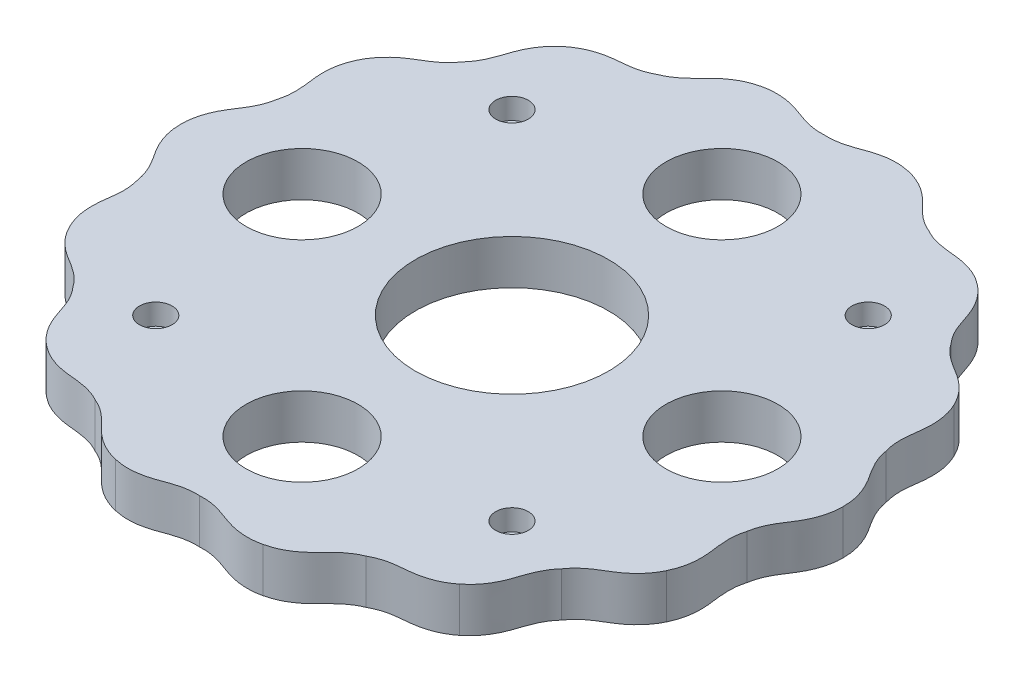
from build123d import *

# Parameters (mm, degrees)
BOSS_EXTRUDE3_DEPTH = 4.7625
SKETCH2_R           = 10.36
SKETCH2_R_2         = 6
CUT_EXTRUDE1_DEPTH  = 4.7625
SKETCH2_4_R         = 1.75
CUT_EXTRUDE2_DEPTH  = 2.2467


with BuildPart() as part:
    # Sketch1 → Boss-Extrude3 (new body)
    with BuildSketch(Plane(origin=(0, 0, 0), x_dir=(1, 0, 0), z_dir=(0, 1, 0))):
        with BuildLine():
            Line((35.500002326, 0.003735881), (35.500002326, 0))
            Line((35.500002326, 0), (35.500002326, -0.003735881))
            add(Edge.make_bspline(
                [(32.644810899, -7.45096506), (32.674793712, -7.260710929), (32.757965618, -6.873262555), (32.975088878, -6.197475635), (33.30681421, -5.487322542), (33.693887271, -4.83935734), (34.139372051, -4.165162167), (34.499748971, -3.6014921), (34.870711868, -2.889611748), (35.149566879, -2.192738575), (35.418263863, -1.23361479), (35.50061524, -0.495919336), (35.500002326, -0.003735881)],
                knots=[0.02301065, 0.02301065, 0.02301065, 0.02301065, 0.053541567, 0.084072485, 0.145134319, 0.206196153, 0.267257988, 0.389381656, 0.511505325, 0.633628994, 0.755752663, 1, 1, 1, 1], degree=3))
            add(Edge.make_bspline(
                [(31.986017844, -15.399507835), (32.200120458, -14.956331799), (32.445998494, -14.255960238), (32.62005909, -13.275236314), (32.671181344, -12.526384626), (32.645828632, -11.724047822), (32.565707523, -11.059836954), (32.456861927, -10.25911949), (32.389262714, -9.507378309), (32.398512397, -8.723622254), (32.496104055, -8.020553026), (32.589276306, -7.635387164), (32.644810899, -7.45096506)],
                knots=[0.02301065, 0.02301065, 0.02301065, 0.02301065, 0.267257988, 0.389381656, 0.511505325, 0.633628994, 0.755752663, 0.816814497, 0.877876331, 0.938938166, 0.969469083, 1, 1, 1, 1], degree=3))
            Line((31.986017844, -15.399507835), (31.984396906, -15.402873748))
            Line((31.984396906, -15.402873748), (31.982775968, -15.406239661))
            add(Edge.make_bspline(
                [(26.179105738, -20.877140171), (26.288667493, -20.718736177), (26.531710341, -20.405744191), (27.020544594, -19.891087467), (27.62754267, -19.395191866), (28.257425012, -18.979340099), (28.951315253, -18.565199839), (29.520570914, -18.213712342), (30.163670245, -17.733285076), (30.717271866, -17.226414698), (31.375507699, -16.478857279), (31.769777787, -15.849947564), (31.982775968, -15.406239661)],
                knots=[0.02301065, 0.02301065, 0.02301065, 0.02301065, 0.053541567, 0.084072485, 0.145134319, 0.206196153, 0.267257988, 0.389381656, 0.511505325, 0.633628994, 0.755752663, 1, 1, 1, 1], degree=3))
            add(Edge.make_bspline(
                [(22.136810246, -27.752690162), (22.521996911, -27.446297993), (23.047405198, -26.921967502), (23.62974854, -26.113887841), (24.00072267, -25.461376898), (24.326001557, -24.727496287), (24.542005228, -24.094299727), (24.791357022, -23.325651886), (25.05662051, -22.619026286), (25.405013194, -21.916899767), (25.797990545, -21.325799714), (26.049053047, -21.019203188), (26.179105738, -20.877140171)],
                knots=[0.02301065, 0.02301065, 0.02301065, 0.02301065, 0.267257988, 0.389381656, 0.511505325, 0.633628994, 0.755752663, 0.816814497, 0.877876331, 0.938938166, 0.969469083, 1, 1, 1, 1], degree=3))
            Line((22.136810246, -27.752690162), (22.133889416, -27.755019446))
            Line((22.133889416, -27.755019446), (22.130968587, -27.75734873))
            add(Edge.make_bspline(
                [(14.52830762, -30.168341629), (14.695748267, -30.073161626), (15.05052444, -29.89661793), (15.714250068, -29.645025478), (16.476297475, -29.461605575), (17.224233175, -29.360231784), (18.029095404, -29.288171996), (18.694481743, -29.218483478), (19.482343797, -29.064663811), (20.201044438, -28.848188121), (21.118447439, -28.460259983), (21.746546212, -28.06469929), (22.130968587, -27.75734873)],
                knots=[0.02301065, 0.02301065, 0.02301065, 0.02301065, 0.053541567, 0.084072485, 0.145134319, 0.206196153, 0.267257988, 0.389381656, 0.511505325, 0.633628994, 0.755752663, 1, 1, 1, 1], degree=3))
            add(Edge.make_bspline(
                [(7.903135888, -34.609111839), (8.383115662, -34.500188263), (9.083990645, -34.255748926), (9.959276491, -33.780363616), (10.576626521, -33.353431213), (11.188111536, -32.833360849), (11.657457809, -32.356590942), (12.215619812, -31.772252855), (12.761207314, -31.250698702), (13.379739556, -30.769266488), (13.990268616, -30.407210225), (14.349495361, -30.239908237), (14.52830762, -30.168341629)],
                knots=[0.02301065, 0.02301065, 0.02301065, 0.02301065, 0.267257988, 0.389381656, 0.511505325, 0.633628994, 0.755752663, 0.816814497, 0.877876331, 0.938938166, 0.969469083, 1, 1, 1, 1], degree=3))
            Line((7.903135888, -34.609111839), (7.899493673, -34.60994315))
            Line((7.899493673, -34.60994315), (7.895851458, -34.610774462))
            add(Edge.make_bspline(
                [(0, -33.484333037), (0.192155866, -33.471228592), (0.588397592, -33.466099831), (1.295555593, -33.527402621), (2.061719496, -33.692786976), (2.779570716, -33.925969485), (3.535992098, -34.210262493), (4.165721189, -34.43617562), (4.942300224, -34.639429423), (5.683752409, -34.756224087), (6.678619663, -34.804759157), (7.416144457, -34.72089313), (7.895851458, -34.610774462)],
                knots=[0.02301065, 0.02301065, 0.02301065, 0.02301065, 0.053541567, 0.084072485, 0.145134319, 0.206196153, 0.267257988, 0.389381656, 0.511505325, 0.633628994, 0.755752663, 1, 1, 1, 1], degree=3))
            add(Edge.make_bspline(
                [(-7.895851458, -34.610774462), (-7.416144457, -34.72089313), (-6.678619663, -34.804759157), (-5.683752409, -34.756224087), (-4.942300224, -34.639429423), (-4.165721189, -34.43617562), (-3.535992098, -34.210262493), (-2.779570716, -33.925969485), (-2.061719496, -33.692786976), (-1.295555593, -33.527402621), (-0.588397592, -33.466099831), (-0.192155866, -33.471228592), (0, -33.484333037)],
                knots=[0.02301065, 0.02301065, 0.02301065, 0.02301065, 0.267257988, 0.389381656, 0.511505325, 0.633628994, 0.755752663, 0.816814497, 0.877876331, 0.938938166, 0.969469083, 1, 1, 1, 1], degree=3))
            Line((-7.895851458, -34.610774462), (-7.899493673, -34.60994315))
            Line((-7.899493673, -34.60994315), (-7.903135888, -34.609111839))
            add(Edge.make_bspline(
                [(-14.52830762, -30.168341629), (-14.349495361, -30.239908237), (-13.990268616, -30.407210225), (-13.379739556, -30.769266488), (-12.761207314, -31.250698702), (-12.215619812, -31.772252855), (-11.657457809, -32.356590942), (-11.188111536, -32.833360849), (-10.576626521, -33.353431213), (-9.959276491, -33.780363616), (-9.083990645, -34.255748926), (-8.383115662, -34.500188263), (-7.903135888, -34.609111839)],
                knots=[0.02301065, 0.02301065, 0.02301065, 0.02301065, 0.053541567, 0.084072485, 0.145134319, 0.206196153, 0.267257988, 0.389381656, 0.511505325, 0.633628994, 0.755752663, 1, 1, 1, 1], degree=3))
            add(Edge.make_bspline(
                [(-22.130968587, -27.75734873), (-21.746546212, -28.06469929), (-21.118447439, -28.460259983), (-20.201044438, -28.848188121), (-19.482343797, -29.064663811), (-18.694481743, -29.218483478), (-18.029095404, -29.288171996), (-17.224233175, -29.360231784), (-16.476297475, -29.461605575), (-15.714250068, -29.645025478), (-15.05052444, -29.89661793), (-14.695748267, -30.073161626), (-14.52830762, -30.168341629)],
                knots=[0.02301065, 0.02301065, 0.02301065, 0.02301065, 0.267257988, 0.389381656, 0.511505325, 0.633628994, 0.755752663, 0.816814497, 0.877876331, 0.938938166, 0.969469083, 1, 1, 1, 1], degree=3))
            Line((-22.130968587, -27.75734873), (-22.133889416, -27.755019446))
            Line((-22.133889416, -27.755019446), (-22.136810246, -27.752690162))
            add(Edge.make_bspline(
                [(-26.179105738, -20.877140171), (-26.049053047, -21.019203188), (-25.797990545, -21.325799714), (-25.405013194, -21.916899767), (-25.05662051, -22.619026286), (-24.791357022, -23.325651886), (-24.542005228, -24.094299727), (-24.326001557, -24.727496287), (-24.00072267, -25.461376898), (-23.62974854, -26.113887841), (-23.047405198, -26.921967502), (-22.521996911, -27.446297993), (-22.136810246, -27.752690162)],
                knots=[0.02301065, 0.02301065, 0.02301065, 0.02301065, 0.053541567, 0.084072485, 0.145134319, 0.206196153, 0.267257988, 0.389381656, 0.511505325, 0.633628994, 0.755752663, 1, 1, 1, 1], degree=3))
            add(Edge.make_bspline(
                [(-31.982775968, -15.406239661), (-31.769777787, -15.849947564), (-31.375507698, -16.478857279), (-30.717271866, -17.226414698), (-30.163670245, -17.733285076), (-29.520570914, -18.213712342), (-28.951315253, -18.565199839), (-28.257425012, -18.979340099), (-27.62754267, -19.395191866), (-27.020544594, -19.891087467), (-26.531710341, -20.405744191), (-26.288667493, -20.718736177), (-26.179105738, -20.877140171)],
                knots=[0.02301065, 0.02301065, 0.02301065, 0.02301065, 0.267257988, 0.389381656, 0.511505325, 0.633628994, 0.755752663, 0.816814497, 0.877876331, 0.938938166, 0.969469083, 1, 1, 1, 1], degree=3))
            Line((-31.982775968, -15.406239661), (-31.984396906, -15.402873748))
            Line((-31.984396906, -15.402873748), (-31.986017844, -15.399507835))
            add(Edge.make_bspline(
                [(-32.644810899, -7.45096506), (-32.589276306, -7.635387164), (-32.496104055, -8.020553026), (-32.398512397, -8.723622254), (-32.389262714, -9.507378309), (-32.456861927, -10.25911949), (-32.565707523, -11.059836954), (-32.645828632, -11.724047822), (-32.671181344, -12.526384626), (-32.62005909, -13.275236314), (-32.445998494, -14.255960238), (-32.200120458, -14.956331799), (-31.986017844, -15.399507835)],
                knots=[0.02301065, 0.02301065, 0.02301065, 0.02301065, 0.053541567, 0.084072485, 0.145134319, 0.206196153, 0.267257988, 0.389381656, 0.511505325, 0.633628994, 0.755752663, 1, 1, 1, 1], degree=3))
            add(Edge.make_bspline(
                [(-35.500002326, -0.003735881), (-35.50061524, -0.495919336), (-35.418263863, -1.23361479), (-35.149566879, -2.192738575), (-34.870711868, -2.889611748), (-34.499748971, -3.6014921), (-34.139372051, -4.165162167), (-33.693887271, -4.83935734), (-33.30681421, -5.487322542), (-32.975088878, -6.197475635), (-32.757965618, -6.873262555), (-32.674793712, -7.260710929), (-32.644810899, -7.45096506)],
                knots=[0.02301065, 0.02301065, 0.02301065, 0.02301065, 0.267257988, 0.389381656, 0.511505325, 0.633628994, 0.755752663, 0.816814497, 0.877876331, 0.938938166, 0.969469083, 1, 1, 1, 1], degree=3))
            Line((-35.500002326, -0.003735881), (-35.500002326, 0))
            Line((-35.500002326, 0), (-35.500002326, 0.003735881))
            add(Edge.make_bspline(
                [(-32.644810899, 7.45096506), (-32.674793712, 7.260710929), (-32.757965618, 6.873262555), (-32.975088878, 6.197475635), (-33.30681421, 5.487322542), (-33.693887271, 4.83935734), (-34.139372051, 4.165162167), (-34.499748971, 3.6014921), (-34.870711868, 2.889611748), (-35.149566879, 2.192738575), (-35.418263863, 1.23361479), (-35.50061524, 0.495919336), (-35.500002326, 0.003735881)],
                knots=[0.02301065, 0.02301065, 0.02301065, 0.02301065, 0.053541567, 0.084072485, 0.145134319, 0.206196153, 0.267257988, 0.389381656, 0.511505325, 0.633628994, 0.755752663, 1, 1, 1, 1], degree=3))
            add(Edge.make_bspline(
                [(-31.986017844, 15.399507835), (-32.200120458, 14.956331799), (-32.445998494, 14.255960238), (-32.62005909, 13.275236314), (-32.671181344, 12.526384626), (-32.645828632, 11.724047822), (-32.565707523, 11.059836954), (-32.456861927, 10.25911949), (-32.389262714, 9.507378309), (-32.398512397, 8.723622254), (-32.496104055, 8.020553026), (-32.589276306, 7.635387164), (-32.644810899, 7.45096506)],
                knots=[0.02301065, 0.02301065, 0.02301065, 0.02301065, 0.267257988, 0.389381656, 0.511505325, 0.633628994, 0.755752663, 0.816814497, 0.877876331, 0.938938166, 0.969469083, 1, 1, 1, 1], degree=3))
            Line((-31.986017844, 15.399507835), (-31.984396906, 15.402873748))
            Line((-31.984396906, 15.402873748), (-31.982775968, 15.406239661))
            add(Edge.make_bspline(
                [(-26.179105738, 20.877140171), (-26.288667493, 20.718736177), (-26.531710341, 20.405744191), (-27.020544594, 19.891087467), (-27.62754267, 19.395191866), (-28.257425012, 18.979340099), (-28.951315253, 18.565199839), (-29.520570914, 18.213712342), (-30.163670245, 17.733285076), (-30.717271866, 17.226414698), (-31.375507699, 16.478857278), (-31.769777787, 15.849947564), (-31.982775968, 15.406239661)],
                knots=[0.02301065, 0.02301065, 0.02301065, 0.02301065, 0.053541567, 0.084072485, 0.145134319, 0.206196153, 0.267257988, 0.389381656, 0.511505325, 0.633628994, 0.755752663, 1, 1, 1, 1], degree=3))
            add(Edge.make_bspline(
                [(-22.136810246, 27.752690162), (-22.521996911, 27.446297993), (-23.047405198, 26.921967502), (-23.62974854, 26.113887841), (-24.00072267, 25.461376898), (-24.326001557, 24.727496287), (-24.542005228, 24.094299727), (-24.791357022, 23.325651886), (-25.05662051, 22.619026286), (-25.405013194, 21.916899767), (-25.797990545, 21.325799714), (-26.049053047, 21.019203188), (-26.179105738, 20.877140171)],
                knots=[0.02301065, 0.02301065, 0.02301065, 0.02301065, 0.267257988, 0.389381656, 0.511505325, 0.633628994, 0.755752663, 0.816814497, 0.877876331, 0.938938166, 0.969469083, 1, 1, 1, 1], degree=3))
            Line((-22.136810246, 27.752690162), (-22.133889416, 27.755019446))
            Line((-22.133889416, 27.755019446), (-22.130968587, 27.75734873))
            add(Edge.make_bspline(
                [(-14.52830762, 30.168341629), (-14.695748267, 30.073161626), (-15.05052444, 29.89661793), (-15.714250068, 29.645025478), (-16.476297475, 29.461605575), (-17.224233175, 29.360231784), (-18.029095404, 29.288171996), (-18.694481743, 29.218483478), (-19.482343797, 29.064663811), (-20.201044438, 28.848188121), (-21.118447439, 28.460259983), (-21.746546212, 28.06469929), (-22.130968587, 27.75734873)],
                knots=[0.02301065, 0.02301065, 0.02301065, 0.02301065, 0.053541567, 0.084072485, 0.145134319, 0.206196153, 0.267257988, 0.389381656, 0.511505325, 0.633628994, 0.755752663, 1, 1, 1, 1], degree=3))
            add(Edge.make_bspline(
                [(-7.903135888, 34.609111839), (-8.383115662, 34.500188263), (-9.083990645, 34.255748926), (-9.959276491, 33.780363616), (-10.576626521, 33.353431213), (-11.188111536, 32.833360849), (-11.657457809, 32.356590942), (-12.215619812, 31.772252855), (-12.761207314, 31.250698702), (-13.379739556, 30.769266488), (-13.990268616, 30.407210225), (-14.349495361, 30.239908237), (-14.52830762, 30.168341629)],
                knots=[0.02301065, 0.02301065, 0.02301065, 0.02301065, 0.267257988, 0.389381656, 0.511505325, 0.633628994, 0.755752663, 0.816814497, 0.877876331, 0.938938166, 0.969469083, 1, 1, 1, 1], degree=3))
            Line((-7.903135888, 34.609111839), (-7.899493673, 34.60994315))
            Line((-7.899493673, 34.60994315), (-7.895851458, 34.610774462))
            add(Edge.make_bspline(
                [(0, 33.484333037), (-0.192155866, 33.471228592), (-0.588397592, 33.466099831), (-1.295555593, 33.527402621), (-2.061719496, 33.692786976), (-2.779570716, 33.925969485), (-3.535992098, 34.210262493), (-4.165721189, 34.43617562), (-4.942300224, 34.639429423), (-5.683752409, 34.756224087), (-6.678619663, 34.804759157), (-7.416144457, 34.72089313), (-7.895851458, 34.610774462)],
                knots=[0.02301065, 0.02301065, 0.02301065, 0.02301065, 0.053541567, 0.084072485, 0.145134319, 0.206196153, 0.267257988, 0.389381656, 0.511505325, 0.633628994, 0.755752663, 1, 1, 1, 1], degree=3))
            add(Edge.make_bspline(
                [(7.895851458, 34.610774462), (7.416144457, 34.72089313), (6.678619663, 34.804759157), (5.683752409, 34.756224087), (4.942300224, 34.639429423), (4.165721189, 34.43617562), (3.535992098, 34.210262493), (2.779570716, 33.925969485), (2.061719496, 33.692786976), (1.295555593, 33.527402621), (0.588397592, 33.466099831), (0.192155866, 33.471228592), (0, 33.484333037)],
                knots=[0.02301065, 0.02301065, 0.02301065, 0.02301065, 0.267257988, 0.389381656, 0.511505325, 0.633628994, 0.755752663, 0.816814497, 0.877876331, 0.938938166, 0.969469083, 1, 1, 1, 1], degree=3))
            Line((7.895851458, 34.610774462), (7.899493673, 34.60994315))
            Line((7.899493673, 34.60994315), (7.903135888, 34.609111839))
            add(Edge.make_bspline(
                [(14.52830762, 30.168341629), (14.349495361, 30.239908237), (13.990268616, 30.407210225), (13.379739556, 30.769266488), (12.761207314, 31.250698702), (12.215619812, 31.772252855), (11.657457809, 32.356590942), (11.188111536, 32.833360849), (10.576626521, 33.353431213), (9.959276491, 33.780363616), (9.083990645, 34.255748926), (8.383115662, 34.500188263), (7.903135888, 34.609111839)],
                knots=[0.02301065, 0.02301065, 0.02301065, 0.02301065, 0.053541567, 0.084072485, 0.145134319, 0.206196153, 0.267257988, 0.389381656, 0.511505325, 0.633628994, 0.755752663, 1, 1, 1, 1], degree=3))
            add(Edge.make_bspline(
                [(22.130968587, 27.75734873), (21.746546212, 28.06469929), (21.118447439, 28.460259983), (20.201044438, 28.848188121), (19.482343797, 29.064663811), (18.694481743, 29.218483478), (18.029095404, 29.288171996), (17.224233175, 29.360231784), (16.476297475, 29.461605575), (15.714250068, 29.645025478), (15.05052444, 29.89661793), (14.695748267, 30.073161626), (14.52830762, 30.168341629)],
                knots=[0.02301065, 0.02301065, 0.02301065, 0.02301065, 0.267257988, 0.389381656, 0.511505325, 0.633628994, 0.755752663, 0.816814497, 0.877876331, 0.938938166, 0.969469083, 1, 1, 1, 1], degree=3))
            Line((22.130968587, 27.75734873), (22.133889416, 27.755019446))
            Line((22.133889416, 27.755019446), (22.136810246, 27.752690162))
            add(Edge.make_bspline(
                [(26.179105738, 20.877140171), (26.049053047, 21.019203188), (25.797990545, 21.325799714), (25.405013194, 21.916899767), (25.05662051, 22.619026286), (24.791357022, 23.325651886), (24.542005228, 24.094299727), (24.326001557, 24.727496287), (24.00072267, 25.461376898), (23.62974854, 26.113887841), (23.047405198, 26.921967502), (22.521996911, 27.446297993), (22.136810246, 27.752690162)],
                knots=[0.02301065, 0.02301065, 0.02301065, 0.02301065, 0.053541567, 0.084072485, 0.145134319, 0.206196153, 0.267257988, 0.389381656, 0.511505325, 0.633628994, 0.755752663, 1, 1, 1, 1], degree=3))
            add(Edge.make_bspline(
                [(31.982775968, 15.406239661), (31.769777787, 15.849947564), (31.375507698, 16.478857279), (30.717271866, 17.226414698), (30.163670245, 17.733285076), (29.520570914, 18.213712342), (28.951315253, 18.565199839), (28.257425012, 18.979340099), (27.62754267, 19.395191866), (27.020544594, 19.891087467), (26.531710341, 20.405744191), (26.288667493, 20.718736177), (26.179105738, 20.877140171)],
                knots=[0.02301065, 0.02301065, 0.02301065, 0.02301065, 0.267257988, 0.389381656, 0.511505325, 0.633628994, 0.755752663, 0.816814497, 0.877876331, 0.938938166, 0.969469083, 1, 1, 1, 1], degree=3))
            Line((31.982775968, 15.406239661), (31.984396906, 15.402873748))
            Line((31.984396906, 15.402873748), (31.986017844, 15.399507835))
            add(Edge.make_bspline(
                [(32.644810899, 7.45096506), (32.589276306, 7.635387164), (32.496104055, 8.020553026), (32.398512397, 8.723622254), (32.389262714, 9.507378309), (32.456861927, 10.25911949), (32.565707523, 11.059836954), (32.645828632, 11.724047822), (32.671181344, 12.526384626), (32.62005909, 13.275236314), (32.445998494, 14.255960238), (32.200120458, 14.956331799), (31.986017844, 15.399507835)],
                knots=[0.02301065, 0.02301065, 0.02301065, 0.02301065, 0.053541567, 0.084072485, 0.145134319, 0.206196153, 0.267257988, 0.389381656, 0.511505325, 0.633628994, 0.755752663, 1, 1, 1, 1], degree=3))
            add(Edge.make_bspline(
                [(35.500002326, 0.003735881), (35.50061524, 0.495919336), (35.418263863, 1.23361479), (35.149566879, 2.192738575), (34.870711868, 2.889611748), (34.499748971, 3.6014921), (34.139372051, 4.165162167), (33.693887271, 4.83935734), (33.30681421, 5.487322542), (32.975088878, 6.197475635), (32.757965618, 6.873262555), (32.674793712, 7.260710929), (32.644810899, 7.45096506)],
                knots=[0.02301065, 0.02301065, 0.02301065, 0.02301065, 0.267257988, 0.389381656, 0.511505325, 0.633628994, 0.755752663, 0.816814497, 0.877876331, 0.938938166, 0.969469083, 1, 1, 1, 1], degree=3))
        make_face()
    extrude(amount=BOSS_EXTRUDE3_DEPTH)

    # Sketch2 → Cut-Extrude1 (cut)
    with BuildSketch(Plane(origin=(0, 4.7625, 0), x_dir=(1, 0, 0), z_dir=(0, 1, 0))):
        Circle(SKETCH2_R)
        with Locations((22.5, 0)):
            Circle(SKETCH2_R_2)
        with Locations((0, -22.5)):
            Circle(SKETCH2_R_2)
        with Locations((-22.5, 0)):
            Circle(SKETCH2_R_2)
        with Locations((0, 22.5)):
            Circle(SKETCH2_R_2)
    extrude(amount=-CUT_EXTRUDE1_DEPTH, mode=Mode.SUBTRACT)

    # Sketch2<4> → Cut-Extrude2 (cut)
    with BuildSketch(Plane(origin=(0, 4.7625, 0), x_dir=(1, 0, 0), z_dir=(0, 1, 0))):
        with Locations((19.091883092, 19.091883092)):
            Circle(SKETCH2_4_R)
        with Locations((19.091883092, -19.091883092)):
            Circle(SKETCH2_4_R)
        with Locations((-19.091883092, -19.091883092)):
            Circle(SKETCH2_4_R)
        with Locations((-19.091883092, 19.091883092)):
            Circle(SKETCH2_4_R)
    extrude(amount=-CUT_EXTRUDE2_DEPTH, mode=Mode.SUBTRACT)


solid = part.part
